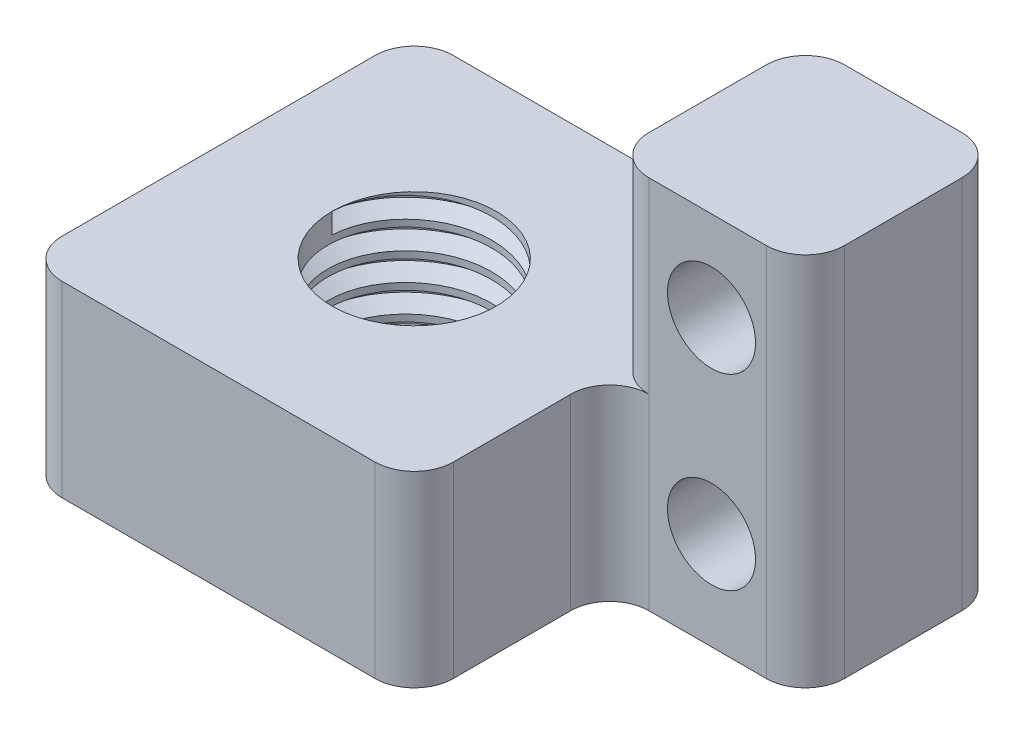
from build123d import *

# Parameters (mm, degrees)
SKETCH1_W           = 5
SKETCH1_H           = 5
SKETCH1_W_2         = 10
SKETCH1_H_2         = 10
SKETCH1_R           = 2.1
BOSS_EXTRUDE1_DEPTH = 4.79289322
SKETCH1_3_W         = 5
SKETCH1_3_H         = 5
BOSS_EXTRUDE2_DEPTH = 9.58578644
THREAD1_PITCH       = 0.7
SKETCH5_R           = 1.125
CUT_EXTRUDE1_DEPTH  = 15.727094237
FILLET2_R           = 1
FILLET3_R           = 1


with BuildPart() as part:
    # Sketch1 → Boss-Extrude1 (new body)
    # profile 1 of 2: a face of its own
    with BuildSketch(Plane(origin=(0, 0, 0), x_dir=(1, 0, 0), z_dir=(0, 1, 0))):
        with Locations((7.5, 2.5)):
            Rectangle(SKETCH1_W, SKETCH1_H)
    # profile 2 of 2: a face of its own
    with BuildSketch(Plane(origin=(0, 0, 0), x_dir=(1, 0, 0), z_dir=(0, 1, 0))):
        Rectangle(SKETCH1_W_2, SKETCH1_H_2)
        with Locations(Location((0, 0, 0), (0, 0, 270))):
            Circle(SKETCH1_R, mode=Mode.SUBTRACT)
    extrude(amount=BOSS_EXTRUDE1_DEPTH)

    # Sketch1<3> → Boss-Extrude2 (add)
    with BuildSketch(Plane(origin=(0, 0, 0), x_dir=(1, 0, 0), z_dir=(0, 1, 0))):
        with Locations((7.5, 2.5)):
            Rectangle(SKETCH1_3_W, SKETCH1_3_H)
    extrude(amount=BOSS_EXTRUDE2_DEPTH)

    # Thread1: the profile of Thread Profile1 profile screwed along a right-hand helix of 7.561276 turns, 6 arcs to a turn; built about Z, then put on its axis
    thread1_z = Axis((0, 0, 0), (0, 0, 1))
    thread1_corners = [(2.0997, 0, -0.000173205), (2.478886113, 0, 0.218749999), (2.478886113, 0, 0.306249999), (2.0997, 0, 0.525173203)]
    with BuildLine(mode=Mode.PRIVATE) as thread1_profile:
        Line(thread1_corners[0], thread1_corners[1])
        Line(thread1_corners[1], thread1_corners[2])
        Line(thread1_corners[2], thread1_corners[3])
        Line(thread1_corners[3], thread1_corners[0])
    thread1_cap = Face(thread1_profile.wire())
    thread1_turn_angles = [0, 30, 60, 90, 120, 150, 180, 210, 240, 270, 300, 330, 360]
    thread1_turn_weights = [1, 0.8660254037844387, 1, 0.8660254037844387, 1, 0.8660254037844387, 1, 0.8660254037844387, 1, 0.8660254037844387, 1, 0.8660254037844387, 1]
    thread1_turn_rails = [Edge.make_bspline([Vector(p[0], p[1], 0).rotate(thread1_z, thread1_turn_angles[k]) / thread1_turn_weights[k] + Vector(0, 0, p[2] + THREAD1_PITCH * thread1_turn_angles[k] / 360) for k in range(13)], [0, 0, 0, 1, 1, 2, 2, 3, 3, 4, 4, 5, 5, 6, 6, 6], 2, thread1_turn_weights) for p in thread1_corners]
    thread1_turn_sides = [Face.make_surface_from_curves(thread1_turn_rails[p[0]], thread1_turn_rails[p[1]]) for p in [(0, 1), (1, 2), (2, 3), (3, 0)]]
    thread1_last_angles = [2520, 2550, 2580, 2610, 2640, 2670, 2700, 2711.029685143, 2722.059370286]
    thread1_last_weights = [1, 0.8660254037844387, 1, 0.8660254037844387, 1, 0.8660254037844387, 1, 0.9815281928975392, 1]
    thread1_last_rails = [Edge.make_bspline([Vector(p[0], p[1], 0).rotate(thread1_z, thread1_last_angles[k]) / thread1_last_weights[k] + Vector(0, 0, p[2] + THREAD1_PITCH * thread1_last_angles[k] / 360) for k in range(9)], [0, 0, 0, 1, 1, 2, 2, 3, 3, 4, 4, 4], 2, thread1_last_weights) for p in thread1_corners]
    thread1_last_sides = [Face.make_surface_from_curves(thread1_last_rails[p[0]], thread1_last_rails[p[1]]) for p in [(0, 1), (1, 2), (2, 3), (3, 0)]]
    thread1 = Plane(origin=(0, 4.79289322, 0), x_dir=(-1, 0, 0), z_dir=(0, -1, 0)) * Solid(Shell([*[p.moved(Location((0, 0, THREAD1_PITCH * i))) for i in range(7) for p in thread1_turn_sides], *thread1_last_sides, thread1_cap, thread1_cap.rotate(thread1_z, 2722.059370286).moved(Location((0, 0, THREAD1_PITCH * 2722.059370286 / 360)))]))
    add(thread1, mode=Mode.SUBTRACT)

    # Sketch5 → Cut-Extrude1 (cut, through all)
    with BuildSketch(Plane.XY):
        with Locations((7.6, 2.5)):
            Circle(SKETCH5_R)
        with Locations((7.6, 7.29)):
            Circle(SKETCH5_R)
    extrude(amount=-CUT_EXTRUDE1_DEPTH, mode=Mode.SUBTRACT)

    # Fillet2
    fillet2_edges = [part.edges().sort_by_distance(p)[0] for p in [
        (10, 4.79289322, 0),
        (5, 2.39644661, 0),
        (5, 2.39644661, 5),
        (-5, 2.39644661, 5),
        (-5, 2.39644661, -5),
        (10, 4.79289322, -5),
        (5, 7.18933983, -5),
    ]]
    fillet(fillet2_edges, radius=FILLET2_R)

    # Fillet3
    fillet3_edges = [part.edges().sort_by_distance(p)[0] for p in [
        (5, 7.18933983, 0),
    ]]
    fillet(fillet3_edges, radius=FILLET3_R)


solid = part.part
